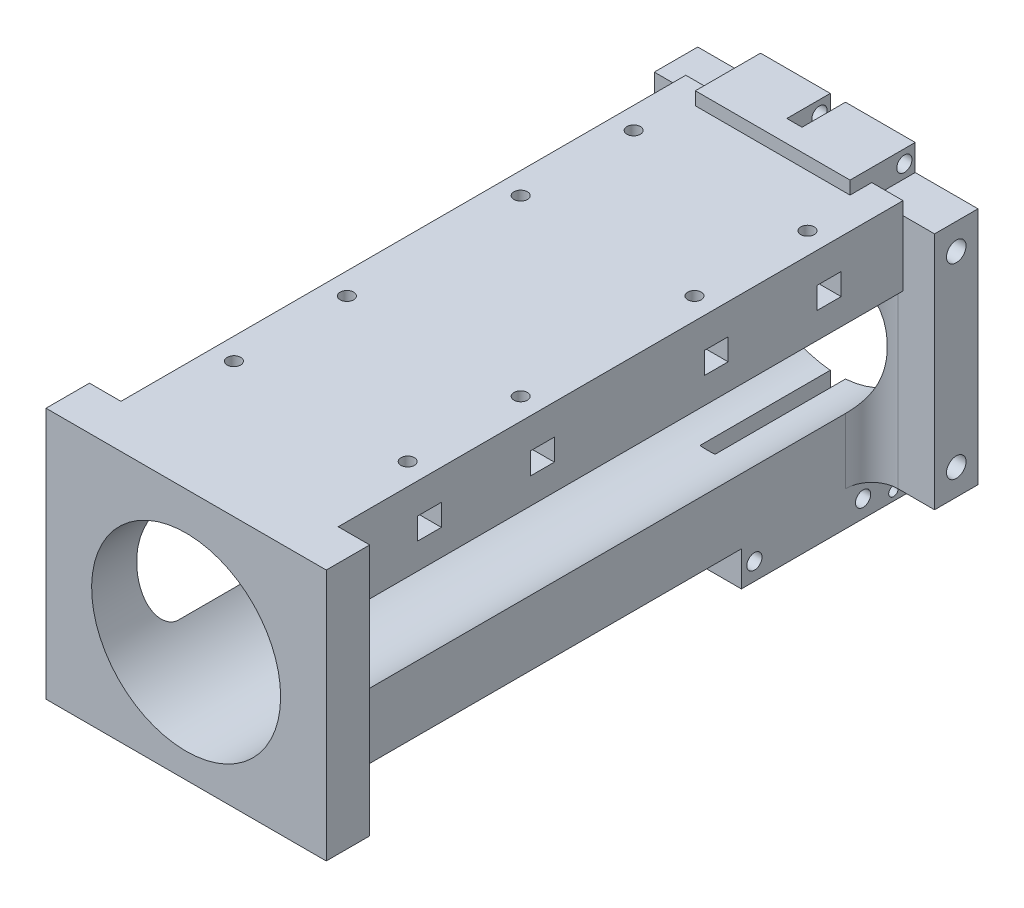
from build123d import *

# Parameters (mm, degrees)
SKETCH_1_W                = 35.6
SKETCH_1_H                = 55
EXTRUDE_1_DEPTH           = 150
SKETCH_4_W                = 64.5
SKETCH_4_H                = 55
EXTRUDE_2_DEPTH           = 10
SKETCH_5_W                = 64.5
SKETCH_5_H                = 55
EXTRUDE_3_DEPTH           = 10
FILLET_1_R                = 6
SKETCH_3_R                = 21.75
CUT_EXTRUDE_1_DEPTH       = 156.872744571
SKETCH_9_W                = 34
SKETCH_9_H                = 5.2
CUT_EXTRUDE_2_DEPTH       = 8
SKETCH_8_R                = 1.75
CUT_EXTRUDE_3_DEPTH       = 5
SKETCH_11_R               = 2.25
CUT_EXTRUDE_4_DEPTH       = 20
SKETCH_12_W               = 6.8
SKETCH_12_H               = 6.8
CUT_EXTRUDE_5_DEPTH       = 10
SKETCH_13_W               = 3.5
SKETCH_13_H               = 15
CUT_EXTRUDE_6_DEPTH       = 30
EXTRUDE_5_DEPTH           = 8
SKETCH_15_R               = 1.1
CUT_EXTRUDE_7_DEPTH       = 90
SKETCH_16_R               = 1.75
CUT_EXTRUDE_8_DEPTH       = 90
SKETCH_17_W               = 35.6
SKETCH_17_H               = 15
EXTRUDE_6_DEPTH           = 6
SKETCH_18_R               = 1.75
CUT_EXTRUDE_9_DEPTH       = 60
SKETCH_19_W               = 3.5
SKETCH_19_H               = 13.252580268
CUT_EXTRUDE_10_DEPTH      = 10
MIRROR_7_COPY_1_SKETCH_W  = 34
MIRROR_7_COPY_1_SKETCH_H  = 5.2
MIRROR_7_COPY_1_DEPTH     = 8
MIRROR_7_COPY_2_SKETCH_W  = 34
MIRROR_7_COPY_2_SKETCH_H  = 5.2
MIRROR_7_COPY_2_DEPTH     = 8
SKETCH_20_W               = 8
SKETCH_20_H               = 17
EXTRUDE_7_DEPTH           = 8
SKETCH_22_W               = 130
SKETCH_22_H               = 15.001100048
EXTRUDE_8_DEPTH           = 25
CUT_EXTRUDE_11_DEPTH      = 158.481149761
CUT_EXTRUDE_11_DEPTH_BACK = 158.481149761
SKETCH_21_R               = 21.75
EXTRUDE_9_DEPTH           = 3
SKETCH_24_R               = 1.55
CUT_EXTRUDE_12_DEPTH      = 12
SKETCH_25_W               = 8.2
SKETCH_25_H               = 5.5
CUT_EXTRUDE_13_DEPTH      = 5
SKETCH_26_W               = 7.2
SKETCH_26_H               = 5
EXTRUDE_10_DEPTH          = 3


with BuildPart() as part:
    # 草图1 → 凸台-拉伸1 (new body)
    with BuildSketch(Plane.XY):
        Rectangle(SKETCH_1_W, SKETCH_1_H)
    extrude(amount=EXTRUDE_1_DEPTH)

    # 草图4 → 凸台-拉伸2 (add)
    with BuildSketch(Plane.XY):
        Rectangle(SKETCH_4_W, SKETCH_4_H)
    extrude(amount=EXTRUDE_2_DEPTH)

    # 草图5 → 凸台-拉伸3 (add)
    with BuildSketch(Plane.XY.offset(150)):
        Rectangle(SKETCH_5_W, SKETCH_5_H)
    extrude(amount=-EXTRUDE_3_DEPTH)

    # 圆角1
    fillet_1_edges = [part.edges().sort_by_distance(p)[0] for p in [
        (-17.8, 0, 10),
        (-17.8, 0, 140),
        (17.8, 0, 140),
        (17.8, 0, 10),
    ]]
    fillet(fillet_1_edges, radius=FILLET_1_R)

    # 草图3 → 切除-拉伸1 (cut, through all)
    with BuildSketch(Plane.XY):
        Circle(SKETCH_3_R)
    extrude(amount=CUT_EXTRUDE_1_DEPTH, mode=Mode.SUBTRACT)

    # 草图9 → 切除-拉伸2 (cut)
    with BuildSketch(Plane(origin=(17.8, 0, 0), x_dir=(0, 0, -1), z_dir=(1, 0, 0))):
        with Locations((-40, 20.9)):
            Rectangle(SKETCH_9_W, SKETCH_9_H)
    cut_extrude_2 = extrude(amount=-CUT_EXTRUDE_2_DEPTH, mode=Mode.SUBTRACT)

    # 草图8 → 切除-拉伸3 (cut)
    with BuildSketch(Plane(origin=(0, 27.5, 0), x_dir=(1, 0, 0), z_dir=(0, 1, 0))):
        with Locations((14, -53)):
            Circle(SKETCH_8_R)
        with Locations((14, -27)):
            Circle(SKETCH_8_R)
        with Locations((-14, -27)):
            Circle(SKETCH_8_R)
        with Locations((-14, -53)):
            Circle(SKETCH_8_R)
    cut_extrude_3 = extrude(amount=-CUT_EXTRUDE_3_DEPTH, mode=Mode.SUBTRACT)

    # 草图11 → 切除-拉伸4 (cut)
    with BuildSketch(Plane(origin=(32.25, 0, 0), x_dir=(0, 0, -1), z_dir=(1, 0, 0))):
        with Locations((-5, 21.5)):
            Circle(SKETCH_11_R)
        with Locations((-5, -21.5)):
            Circle(SKETCH_11_R)
    cut_extrude_4 = extrude(amount=-CUT_EXTRUDE_4_DEPTH, mode=Mode.SUBTRACT)

    # 草图12 → 切除-拉伸5 (cut)
    with BuildSketch(Plane(origin=(0, 0, 0), x_dir=(-1, 0, 0), z_dir=(0, 0, -1))):
        with Locations((-20.25, 21.1)):
            Rectangle(SKETCH_12_W, SKETCH_12_H)
        with Locations((-20.25, -21.5)):
            Rectangle(SKETCH_12_W, SKETCH_12_H)
    cut_extrude_5 = extrude(amount=-CUT_EXTRUDE_5_DEPTH, mode=Mode.SUBTRACT)

    # 草图13 → 切除-拉伸6 (cut)
    with BuildSketch(Plane(origin=(0, 0, 0), x_dir=(-1, 0, 0), z_dir=(0, 0, -1))):
        with Locations((0, -20)):
            Rectangle(SKETCH_13_W, SKETCH_13_H)
    extrude(amount=-CUT_EXTRUDE_6_DEPTH, mode=Mode.SUBTRACT)

    # 草图14 → 凸台-拉伸5 (add)
    with BuildSketch(Plane.XZ.offset(27.5)):
        Polygon((-17.8, 16), (-17.8, 0), (-1.75, 0), (-1.75, 30), (1.75, 30), (1.75, 0), (17.8, 0), (17.8, 16), (17.8, 40), (-17.8, 40), align=None)
    extrude(amount=EXTRUDE_5_DEPTH)

    # 草图15 → 切除-拉伸7 (cut)
    with BuildSketch(Plane(origin=(17.8, 0, 0), x_dir=(0, 0, -1), z_dir=(1, 0, 0))):
        with Locations((-5, -33.5)):
            Circle(SKETCH_15_R)
    extrude(amount=-CUT_EXTRUDE_7_DEPTH, mode=Mode.SUBTRACT)

    # 草图16 → 切除-拉伸8 (cut)
    with BuildSketch(Plane(origin=(17.8, 0, 0), x_dir=(0, 0, -1), z_dir=(1, 0, 0))):
        with Locations((-37, -31.5)):
            Circle(SKETCH_16_R)
        with Locations((-12, -31.5)):
            Circle(SKETCH_16_R)
    extrude(amount=-CUT_EXTRUDE_8_DEPTH, mode=Mode.SUBTRACT)

    # 草图17 → 凸台-拉伸6 (add)
    with BuildSketch(Plane(origin=(0, 27.5, 0), x_dir=(1, 0, 0), z_dir=(0, 1, 0))):
        with Locations((0, -7.5)):
            Rectangle(SKETCH_17_W, SKETCH_17_H)
    extrude(amount=EXTRUDE_6_DEPTH)

    # 草图18 → 切除-拉伸9 (cut)
    with BuildSketch(Plane(origin=(17.8, 0, 0), x_dir=(0, 0, -1), z_dir=(1, 0, 0))):
        with Locations((-2.5, 30.5)):
            Circle(SKETCH_18_R)
    extrude(amount=-CUT_EXTRUDE_9_DEPTH, mode=Mode.SUBTRACT)

    # 草图19 → 切除-拉伸10 (cut)
    with BuildSketch(Plane(origin=(0, 0, 0), x_dir=(-1, 0, 0), z_dir=(0, 0, -1))):
        with Locations((0, 26.873709866)):
            Rectangle(SKETCH_19_W, SKETCH_19_H)
    extrude(amount=-CUT_EXTRUDE_10_DEPTH, mode=Mode.SUBTRACT)

    # 镜向2: 切除-拉伸4, 切除-拉伸5 across plane
    add(cut_extrude_4.mirror(Plane(origin=(0, 0, 0), x_dir=(0, 0, 1), z_dir=(1, 0, 0))), mode=Mode.SUBTRACT)
    add(cut_extrude_5.mirror(Plane(origin=(0, 0, 0), x_dir=(0, 0, 1), z_dir=(1, 0, 0))), mode=Mode.SUBTRACT)

    # 镜向6: 切除-拉伸2 across plane
    add(cut_extrude_2.mirror(Plane(origin=(0, 0, 0), x_dir=(0, 0, 1), z_dir=(1, 0, 0))), mode=Mode.SUBTRACT)

    # 镜向7: 切除-拉伸3 across plane
    add(cut_extrude_3.mirror(Plane.XY.offset(73)), mode=Mode.SUBTRACT)

    # 镜向7 copy 1 sketch → 镜向7 copy 1 (cut)
    with BuildSketch(Plane(origin=(-17.8, 0, 146), x_dir=(0, 0, 1), z_dir=(-1, 0, 0))):
        with Locations((-40, 20.9)):
            Rectangle(MIRROR_7_COPY_1_SKETCH_W, MIRROR_7_COPY_1_SKETCH_H)
    extrude(amount=-MIRROR_7_COPY_1_DEPTH, mode=Mode.SUBTRACT)

    # 镜向7 copy 2 sketch → 镜向7 copy 2 (cut)
    with BuildSketch(Plane(origin=(17.8, 0, 146), x_dir=(0, 0, 1), z_dir=(1, 0, 0))):
        with Locations((-40, -20.9)):
            Rectangle(MIRROR_7_COPY_2_SKETCH_W, MIRROR_7_COPY_2_SKETCH_H)
    extrude(amount=-MIRROR_7_COPY_2_DEPTH, mode=Mode.SUBTRACT)

    # 草图20 → 凸台-拉伸7 (add)
    with BuildSketch(Plane.XZ.offset(-23.5)):
        with Locations((13.8, 40)):
            Rectangle(SKETCH_20_W, SKETCH_20_H)
        with Locations((-13.8, 40)):
            Rectangle(SKETCH_20_W, SKETCH_20_H)
        with Locations((-13.8, 106)):
            Rectangle(SKETCH_20_W, SKETCH_20_H)
        with Locations((13.8, 106)):
            Rectangle(SKETCH_20_W, SKETCH_20_H)
    extrude(amount=EXTRUDE_7_DEPTH)

    # 草图22 → 凸台-拉伸8 (add, symmetric)
    with BuildSketch(Plane(origin=(0, 0, 0), x_dir=(0, 0, -1), z_dir=(1, 0, 0))):
        with Locations((-75, 19.999449976)):
            Rectangle(SKETCH_22_W, SKETCH_22_H)
    extrude(amount=EXTRUDE_8_DEPTH, both=True)

    # 草图21 → 切除-拉伸11 (cut, two sides: drawn at the far end of the back side and taken through both)
    with BuildSketch(Plane.XY.offset(150).offset(-CUT_EXTRUDE_11_DEPTH_BACK)):
        Circle(SKETCH_21_R)
    extrude(amount=CUT_EXTRUDE_11_DEPTH + CUT_EXTRUDE_11_DEPTH_BACK, mode=Mode.SUBTRACT)

    # 草图23 → 凸台-拉伸9 (add)
    with BuildSketch(Plane(origin=(0, 27.5, 0), x_dir=(1, 0, 0), z_dir=(0, 1, 0))):
        Polygon((-25, -15), (25, -15), (25, -140), (32.25, -140), (32.25, -150), (-32.25, -150), (-32.25, -140), (-25, -140), align=None)
    extrude(amount=EXTRUDE_9_DEPTH)

    # 草图24 → 切除-拉伸12 (cut)
    with BuildSketch(Plane(origin=(0, 30.5, 0), x_dir=(1, 0, 0), z_dir=(0, 1, 0))):
        with Locations((-20, -93)):
            Circle(SKETCH_24_R)
        with Locations((-20, -119)):
            Circle(SKETCH_24_R)
        with Locations((20, -93)):
            Circle(SKETCH_24_R)
        with Locations((20, -119)):
            Circle(SKETCH_24_R)
        with Locations((20, -53)):
            Circle(SKETCH_24_R)
        with Locations((-20, -53)):
            Circle(SKETCH_24_R)
        with Locations((-20, -27)):
            Circle(SKETCH_24_R)
        with Locations((20, -27)):
            Circle(SKETCH_24_R)
    extrude(amount=-CUT_EXTRUDE_12_DEPTH, mode=Mode.SUBTRACT)

    # 草图25 → 切除-拉伸13 (cut)
    with BuildSketch(Plane(origin=(0, 23.5, 0), x_dir=(1, 0, 0), z_dir=(0, 1, 0))):
        with Locations((20.9, -27)):
            Rectangle(SKETCH_25_W, SKETCH_25_H)
        with Locations((20.9, -53)):
            Rectangle(SKETCH_25_W, SKETCH_25_H)
        with Locations((-20.9, -27)):
            Rectangle(SKETCH_25_W, SKETCH_25_H)
        with Locations((-20.9, -53)):
            Rectangle(SKETCH_25_W, SKETCH_25_H)
        with Locations((-20.9, -93)):
            Rectangle(SKETCH_25_W, SKETCH_25_H)
        with Locations((-20.9, -119)):
            Rectangle(SKETCH_25_W, SKETCH_25_H)
        with Locations((20.9, -93)):
            Rectangle(SKETCH_25_W, SKETCH_25_H)
        with Locations((20.9, -119)):
            Rectangle(SKETCH_25_W, SKETCH_25_H)
    extrude(amount=-CUT_EXTRUDE_13_DEPTH, mode=Mode.SUBTRACT)

    # 草图26 → 凸台-拉伸10 (add)
    with BuildSketch(Plane(origin=(0, 27.5, 0), x_dir=(1, 0, 0), z_dir=(0, 1, 0))):
        with Locations((21.4, -12.5)):
            Rectangle(SKETCH_26_W, SKETCH_26_H)
        with Locations((-21.4, -12.5)):
            Rectangle(SKETCH_26_W, SKETCH_26_H)
    extrude(amount=EXTRUDE_10_DEPTH)


solid = part.part
